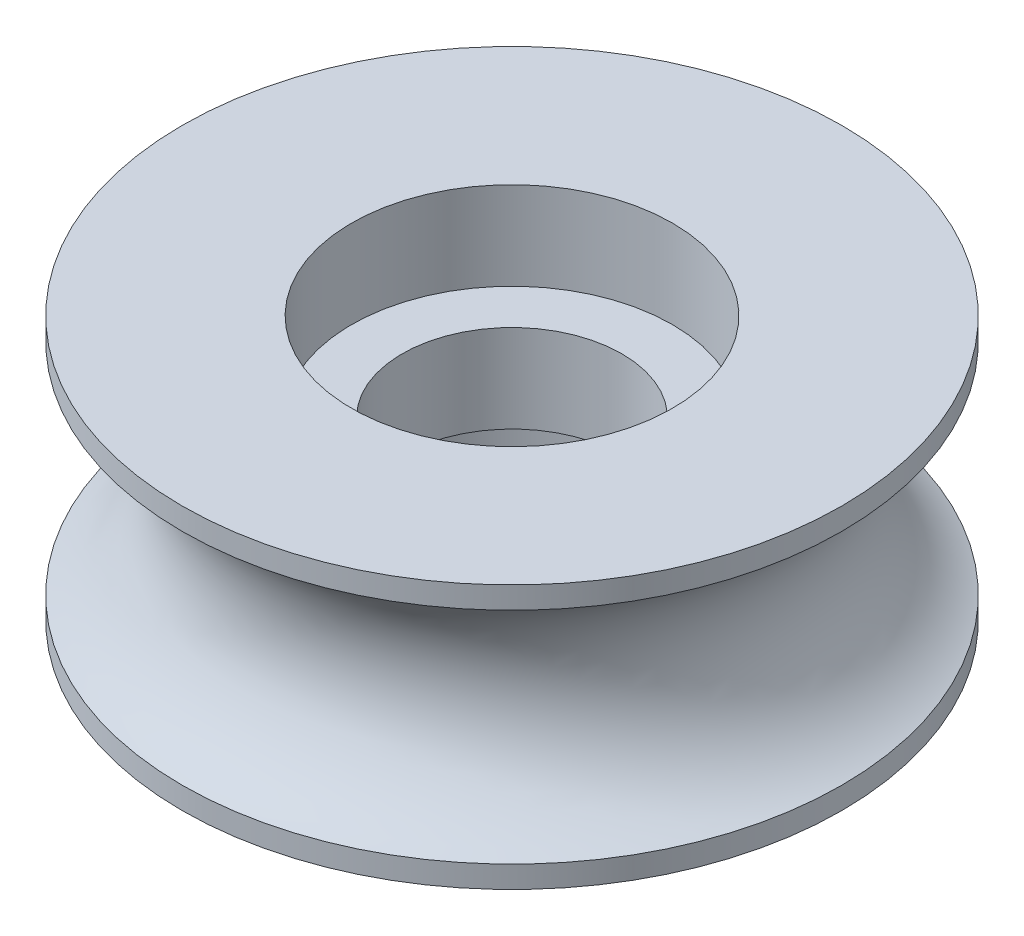
from build123d import *


with BuildPart() as part:
    # Sketch1 → Revolve1 (revolve)
    with BuildSketch(Plane.XY):
        with BuildLine():
            Line((-3.65, 0), (-7.5, 0))
            Line((-7.5, 0), (-7.5, 0.5))
            ThreePointArc((-7.5, 0.5), (-5.819803903, 3), (-7.5, 5.5))
            Line((-7.5, 5.5), (-7.5, 6))
            Line((-7.5, 6), (-3.65, 6))
            Line((-3.65, 6), (-3.65, 4))
            Line((-3.65, 4), (-2.5, 4))
            Line((-2.5, 4), (-2.5, 2))
            Line((-2.5, 2), (-3.65, 2))
            Line((-3.65, 2), (-3.65, 0))
        make_face()
    revolve(axis=Axis((0, -6.629530881, 0), (0, 1, 0)))


solid = part.part
